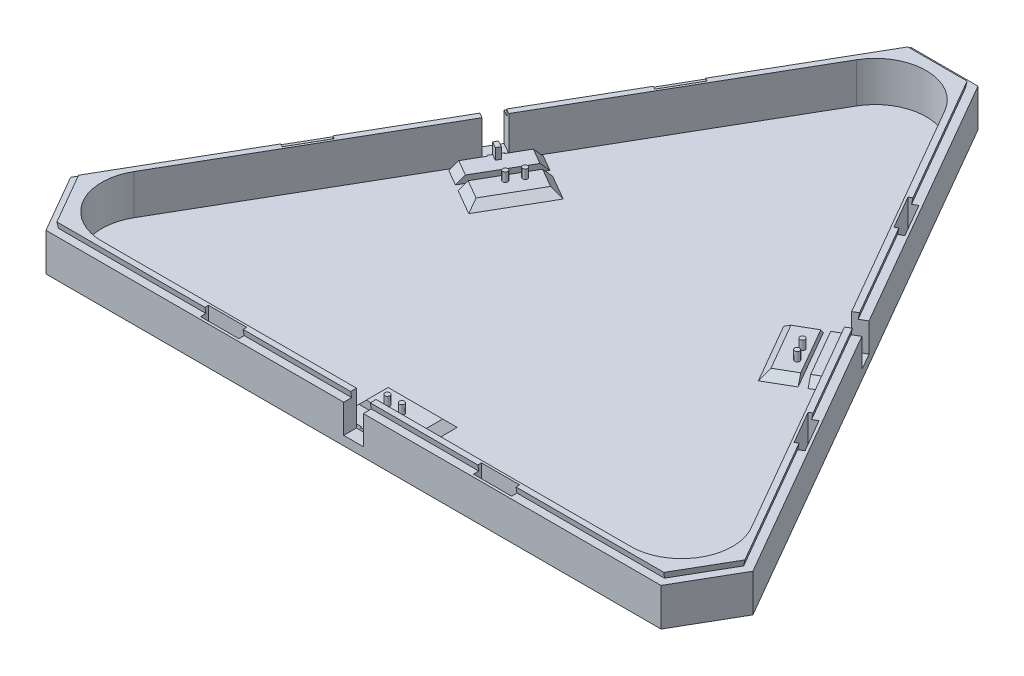
from build123d import *

# Parameters (mm, degrees)
BOSS_EXTRU_1_DEPTH                        = 12
ENL_V_MAT_EXTRU_1_DEPTH                   = 158.792057257
ENL_V_MAT_EXTRU_2_DEPTH                   = 11
ESQUISSE4_W                               = 5.4
ESQUISSE4_H                               = 3.5
ENL_V_MAT_EXTRU_3_DEPTH                   = 9.5
BOSS_EXTRU_2_DEPTH                        = 2
ESQUISSE13_R                              = 0.7
BOSS_EXTRU_3_DEPTH                        = 2.5
BOSS_EXTRU_8_DEPTH                        = 3
CHANFREIN4_SIZE                           = 2
ENL_V_MAT_EXTRU_11_DEPTH                  = 2
R_P_TITION_START                          = 1
R_P_TITION_CIRCULAIRE1_OUTLINE_W          = 1.2
R_P_TITION_CIRCULAIRE1_OUTLINE_H          = 2
R_P_TITION_CIRCULAIRE1_OUTLINE_R          = 0.7
R_P_TITION_CIRCULAIRE1_DEPTH              = 4.5
R_P_TITION_START_2                        = 5.5
R_P_TITION_CIRCULAIRE1_2_OUTLINE_W        = 1.2
R_P_TITION_CIRCULAIRE1_2_OUTLINE_H        = 2
R_P_TITION_CIRCULAIRE1_2_DEPTH            = 0.5
ENL_V_DE_MAT_EXTRU_MINCE1_DEPTH           = 1.6
ENL_V_DE_MAT_EXTRU_MINCE1_DRAFT           = 10
ENL_V_DE_MAT_EXTRU_MINCE1_PROFILE_2_DEPTH = 1.6
ENL_V_DE_MAT_EXTRU_MINCE1_PROFILE_2_DRAFT = 10
ENL_V_DE_MAT_EXTRU_MINCE1_PROFILE_3_DEPTH = 1.6
ENL_V_DE_MAT_EXTRU_MINCE1_PROFILE_3_DRAFT = 10
ESQUISSE18_W                              = 10.5
ESQUISSE18_H                              = 2.2
ENL_V_MAT_EXTRU_10_DEPTH                  = 11


with BuildPart() as part:
    # Esquisse1 → Boss.-Extru.1 (new body)
    with BuildSketch(Plane(origin=(0, 0, 0), x_dir=(1, 0, 0), z_dir=(0, 1, 0))):
        Polygon((-103, -59.467077727), (103, -59.467077727), (0, 118.934155453), align=None)
    extrude(amount=BOSS_EXTRU_1_DEPTH)

    # Esquisse2 → Enlèv. mat.-Extru.1 (cut, through all)
    with BuildSketch(Plane(origin=(0, 12, 0), x_dir=(1, 0, 0), z_dir=(0, 1, 0))):
        Polygon((-9.237604307, 102.934155453), (9.237604307, 102.934155453), (0, 118.934155453), align=None)
        Polygon((103, -59.467077727), (93.762395693, -43.467077727), (84.524791386, -59.467077727), align=None)
        Polygon((-103, -59.467077727), (-84.524791386, -59.467077727), (-93.762395693, -43.467077727), align=None)
    extrude(amount=-ENL_V_MAT_EXTRU_1_DEPTH, mode=Mode.SUBTRACT)

    # Esquisse3 → Enlèv. mat.-Extru.2 (cut)
    with BuildSketch(Plane(origin=(0, 12, 0), x_dir=(1, 0, 0), z_dir=(0, 1, 0))):
        with BuildLine():
            Line((84.813466521, -34.967077727), (12.124355653, 90.934155453))
            ThreePointArc((12.124355653, 90.934155453), (0, 97.934155453), (-12.124355653, 90.934155453))
            Line((-12.124355653, 90.934155453), (-84.813466521, -34.967077727))
            ThreePointArc((-84.813466521, -34.967077727), (-84.813466521, -48.967077727), (-72.689110868, -55.967077727))
            Line((-72.689110868, -55.967077727), (72.689110868, -55.967077727))
            ThreePointArc((72.689110868, -55.967077727), (84.813466521, -48.967077727), (84.813466521, -34.967077727))
        make_face()
    extrude(amount=-ENL_V_MAT_EXTRU_2_DEPTH, mode=Mode.SUBTRACT)

    # Esquisse4 → Enlèv. mat.-Extru.3 (cut)
    with BuildSketch(Plane(origin=(0, 12, 0), x_dir=(1, 0, 0), z_dir=(0, 1, 0))):
        Polygon((49.818911087, 25.645270273), (47.118911087, 30.321807453), (50.15, 32.071807453), (52.85, 27.395270273), align=None)
        with Locations((0, -57.717077727)):
            Rectangle(ESQUISSE4_W, ESQUISSE4_H)
        Polygon((-50.15, 32.071807453), (-47.118911087, 30.321807453), (-49.818911087, 25.645270273), (-52.85, 27.395270273), align=None)
    extrude(amount=-ENL_V_MAT_EXTRU_3_DEPTH, mode=Mode.SUBTRACT)

    # Esquisse12 → Boss.-Extru.2 (add)
    with BuildSketch(Plane(origin=(0, 1, 0), x_dir=(1, 0, 0), z_dir=(0, 1, 0))):
        Polygon((33.027568136, 27.728729392), (40.527568136, 14.738348335), (51.785898385, 21.238348335), (48.910898385, 26.217994407), (49.170706006, 26.367994407), (47.420706006, 29.39908332), (47.160898385, 29.24908332), (44.285898385, 34.228729392), align=None)
    extrude(amount=BOSS_EXTRU_2_DEPTH)

    # Esquisse13 → Boss.-Extru.3 (add)
    with BuildSketch(Plane(origin=(0, 3, 0), x_dir=(1, 0, 0), z_dir=(0, 1, 0))):
        with Locations(Location((40.164874832, 23.766551565, 0), (0, 0, 90))):
            Circle(ESQUISSE13_R)
        with Locations(Location((42.164874832, 20.30244995, 0), (0, 0, 90))):
            Circle(ESQUISSE13_R)
    extrude(amount=BOSS_EXTRU_3_DEPTH)

    # Esquisse20 → Boss.-Extru.8 (add, symmetric)
    with BuildSketch(Plane(origin=(0, 3, 0), x_dir=(1, 0, 0), z_dir=(0, 1, 0))):
        Polygon((47.995706006, 28.403154106), (48.595706006, 27.363923621), (46.863655198, 26.363923621), (46.263655198, 27.403154106), align=None)
    extrude(amount=BOSS_EXTRU_8_DEPTH, both=True)

    # Chanfrein4
    chanfrein4_edges = [part.edges().sort_by_distance(p)[0] for p in [
        (38.65673326, 1, -30.978729392),
        (36.777568136, 1, -21.233538863),
        (46.15673326, 1, -17.988348335),
    ]]
    chamfer(chanfrein4_edges, length=CHANFREIN4_SIZE - 0.0001)  # a hair under: the kernel refuses the full size

    # Esquisse21 → Enlèv. mat.-Extru.11 (cut)
    with BuildSketch(Plane(origin=(0, 3, 0), x_dir=(1, 0, 0), z_dir=(0, 1, 0))):
        Polygon((37.223720558, 32.460780199), (38.955771366, 33.460780199), (48.455771366, 17.006297527), (46.723720558, 16.006297527), align=None)
    extrude(amount=-ENL_V_MAT_EXTRU_11_DEPTH, mode=Mode.SUBTRACT)

    # Répétition circulaire1: read off the stored shape, not the designer's step
    # Répétition circulaire1 outline → Répétition circulaire1 (add)
    with BuildSketch(Plane(origin=(0, 0, 0), x_dir=(1, 0, 0), z_dir=(0, 1, 0)).offset(R_P_TITION_START)):
        Polygon((-47.995706006, 28.403154106), (-48.595706006, 27.363923621), (-46.863655198, 26.363923621), (-46.263655198, 27.403154106), align=None)
        with Locations((0, -54.767077727)):
            Rectangle(R_P_TITION_CIRCULAIRE1_OUTLINE_W, R_P_TITION_CIRCULAIRE1_OUTLINE_H)
        with Locations((-40.664874832, 22.900526161)):
            Circle(R_P_TITION_CIRCULAIRE1_OUTLINE_R)
        with Locations((-38.664874832, 26.364627777)):
            Circle(R_P_TITION_CIRCULAIRE1_OUTLINE_R)
        with Locations((0.5, -46.667077727)):
            Circle(R_P_TITION_CIRCULAIRE1_OUTLINE_R)
        with Locations((-3.5, -46.667077727)):
            Circle(R_P_TITION_CIRCULAIRE1_OUTLINE_R)
    extrude(amount=R_P_TITION_CIRCULAIRE1_DEPTH)

    # R_p_tition circulaire1 2 outline → R_p_tition circulaire1 2 (add)
    with BuildSketch(Plane(origin=(0, 0, 0), x_dir=(1, 0, 0), z_dir=(0, 1, 0)).offset(R_P_TITION_START_2)):
        Polygon((-47.995706006, 28.403154106), (-48.595706006, 27.363923621), (-46.863655198, 26.363923621), (-46.263655198, 27.403154106), align=None)
        with Locations((0, -54.767077727)):
            Rectangle(R_P_TITION_CIRCULAIRE1_2_OUTLINE_W, R_P_TITION_CIRCULAIRE1_2_OUTLINE_H)
    extrude(amount=R_P_TITION_CIRCULAIRE1_2_DEPTH)

    # R_p_tition circulaire1 3: loft between two sections, ruled curve by curve
    r_p_tition_circulaire1_3_from = [
        Edge.make_line((-38.223720558, 3, -30.728729392), (-33.027568136, 3, -27.728729392)),
        Edge.make_line((-45.723720558, 3, -17.738348335), (-40.527568136, 3, -14.738348335)),
        Edge.make_line((-33.027568136, 3, -27.728729392), (-40.527568136, 3, -14.738348335)),
        Edge.make_line((-45.723720558, 3, -17.738348335), (-38.223720558, 3, -30.728729392)),
    ]
    r_p_tition_circulaire1_3_to = [
        Edge.make_line((-37.223720558, 1, -32.460780199), (-30.295517328, 1, -28.460780199)),
        Edge.make_line((-46.723720558, 1, -16.006297527), (-39.795517328, 1, -12.006297527)),
        Edge.make_line((-30.295517328, 1, -28.460780199), (-39.795517328, 1, -12.006297527)),
        Edge.make_line((-46.723720558, 1, -16.006297527), (-37.223720558, 1, -32.460780199)),
    ]
    r_p_tition_circulaire1_3 = Solid(Shell([*[Face.make_surface_from_curves(r_p_tition_circulaire1_3_from[k], r_p_tition_circulaire1_3_to[k]) for k in range(4)], Face(Wire(r_p_tition_circulaire1_3_from)), Face(Wire(r_p_tition_circulaire1_3_to))]))
    add(r_p_tition_circulaire1_3)

    # R_p_tition circulaire1 4: loft between two sections, ruled curve by curve
    r_p_tition_circulaire1_4_from = [
        Edge.make_line((-7.5, 3, 48.467077727), (-7.5, 3, 42.467077727)),
        Edge.make_line((7.5, 3, 48.467077727), (7.5, 3, 42.467077727)),
        Edge.make_line((-7.5, 3, 42.467077727), (7.5, 3, 42.467077727)),
        Edge.make_line((7.5, 3, 48.467077727), (-7.5, 3, 48.467077727)),
    ]
    r_p_tition_circulaire1_4_to = [
        Edge.make_line((-9.5, 1, 48.467077727), (-9.5, 1, 40.467077727)),
        Edge.make_line((9.5, 1, 48.467077727), (9.5, 1, 40.467077727)),
        Edge.make_line((-9.5, 1, 40.467077727), (9.5, 1, 40.467077727)),
        Edge.make_line((9.5, 1, 48.467077727), (-9.5, 1, 48.467077727)),
    ]
    r_p_tition_circulaire1_4 = Solid(Shell([*[Face.make_surface_from_curves(r_p_tition_circulaire1_4_from[k], r_p_tition_circulaire1_4_to[k]) for k in range(4)], Face(Wire(r_p_tition_circulaire1_4_from)), Face(Wire(r_p_tition_circulaire1_4_to))]))
    add(r_p_tition_circulaire1_4)

    # R_p_tition circulaire1 5: loft between two sections, ruled curve by curve
    r_p_tition_circulaire1_5_from = [
        Edge.make_line((-39.955771366, 3, -31.728729392), (-44.285898385, 3, -34.228729392)),
        Edge.make_line((-47.455771366, 3, -18.738348335), (-51.785898385, 3, -21.238348335)),
        Edge.make_line((-47.160898385, 3, -29.24908332), (-44.285898385, 3, -34.228729392)),
        Edge.make_line((-51.785898385, 3, -21.238348335), (-48.910898385, 3, -26.217994407)),
        Edge.make_line((-47.420706006, 3, -29.39908332), (-47.160898385, 3, -29.24908332)),
        Edge.make_line((-48.910898385, 3, -26.217994407), (-49.170706006, 3, -26.367994407)),
        Edge.make_line((-39.955771366, 3, -31.728729392), (-47.455771366, 3, -18.738348335)),
        Edge.make_line((-49.170706006, 3, -26.367994407), (-47.420706006, 3, -29.39908332)),
    ]
    r_p_tition_circulaire1_5_to = [
        Edge.make_line((-38.955771366, 1, -33.460780199), (-43.285898385, 1, -35.960780199)),
        Edge.make_line((-48.455771366, 1, -17.006297527), (-52.785898385, 1, -19.506297527)),
        Edge.make_line((-47.160898385, 1, -29.24908332), (-43.285898385, 1, -35.960780199)),
        Edge.make_line((-52.785898385, 1, -19.506297527), (-48.910898385, 1, -26.217994407)),
        Edge.make_line((-47.420706006, 1, -29.39908332), (-47.160898385, 1, -29.24908332)),
        Edge.make_line((-48.910898385, 1, -26.217994407), (-49.170706006, 1, -26.367994407)),
        Edge.make_line((-38.955771366, 1, -33.460780199), (-48.455771366, 1, -17.006297527)),
        Edge.make_line((-49.170706006, 1, -26.367994407), (-47.420706006, 1, -29.39908332)),
    ]
    r_p_tition_circulaire1_5 = Solid(Shell([*[Face.make_surface_from_curves(r_p_tition_circulaire1_5_from[k], r_p_tition_circulaire1_5_to[k]) for k in range(8)], Face(Wire(r_p_tition_circulaire1_5_from)), Face(Wire(r_p_tition_circulaire1_5_to))]))
    add(r_p_tition_circulaire1_5)

    # R_p_tition circulaire1 6: loft between two sections, ruled curve by curve
    r_p_tition_circulaire1_6_from = [
        Edge.make_line((-7.5, 3, 50.467077727), (-7.5, 3, 55.467077727)),
        Edge.make_line((7.5, 3, 50.467077727), (7.5, 3, 55.467077727)),
        Edge.make_line((-1.75, 3, 55.467077727), (-7.5, 3, 55.467077727)),
        Edge.make_line((7.5, 3, 55.467077727), (1.75, 3, 55.467077727)),
        Edge.make_line((-1.75, 3, 55.767077727), (-1.75, 3, 55.467077727)),
        Edge.make_line((1.75, 3, 55.467077727), (1.75, 3, 55.767077727)),
        Edge.make_line((-7.5, 3, 50.467077727), (7.5, 3, 50.467077727)),
        Edge.make_line((1.75, 3, 55.767077727), (-1.75, 3, 55.767077727)),
    ]
    r_p_tition_circulaire1_6_to = [
        Edge.make_line((-9.5, 1, 50.467077727), (-9.5, 1, 55.467077727)),
        Edge.make_line((9.5, 1, 50.467077727), (9.5, 1, 55.467077727)),
        Edge.make_line((-1.75, 1, 55.467077727), (-9.5, 1, 55.467077727)),
        Edge.make_line((9.5, 1, 55.467077727), (1.75, 1, 55.467077727)),
        Edge.make_line((-1.75, 1, 55.767077727), (-1.75, 1, 55.467077727)),
        Edge.make_line((1.75, 1, 55.467077727), (1.75, 1, 55.767077727)),
        Edge.make_line((-9.5, 1, 50.467077727), (9.5, 1, 50.467077727)),
        Edge.make_line((1.75, 1, 55.767077727), (-1.75, 1, 55.767077727)),
    ]
    r_p_tition_circulaire1_6 = Solid(Shell([*[Face.make_surface_from_curves(r_p_tition_circulaire1_6_from[k], r_p_tition_circulaire1_6_to[k]) for k in range(8)], Face(Wire(r_p_tition_circulaire1_6_from)), Face(Wire(r_p_tition_circulaire1_6_to))]))
    add(r_p_tition_circulaire1_6)


with BuildPart() as enl_v_de_mat_extru_mince1_tool:
    # Esquisse17 → Enlèv. de mat.-Extru.-Mince1 (with draft: the straight prism first)
    with BuildSketch(Plane(origin=(0, 12, 0), x_dir=(1, 0, 0), z_dir=(0, 1, 0))):
        Polygon((50.15, 32.071807453), (9.237604307, 102.934155453), (-9.237604307, 102.934155453), (-50.15, 32.071807453), (-48.504551733, 31.121807453), (-8.140638796, 101.034155453), (8.140638796, 101.034155453), (48.504551733, 31.121807453), align=None)
    extrude(amount=-ENL_V_DE_MAT_EXTRU_MINCE1_DEPTH)
    # Enlèv. de mat.-Extru.-Mince1: the draft: its side faces are tilted about the plane it starts from
    enl_v_de_mat_extru_mince1_sides = [enl_v_de_mat_extru_mince1_tool.faces().sort_by_distance(p)[0] for p in [
        (29.693802154, 11.2, -67.502981453),
        (0, 11.2, -102.934155453),
        (-29.693802154, 11.2, -67.502981453),
        (-49.327275866, 11.2, -31.596807453),
        (-28.322595264, 11.2, -66.077981453),
        (0, 11.2, -101.034155453),
        (28.322595264, 11.2, -66.077981453),
        (49.327275866, 11.2, -31.596807453),
    ]]
    draft(enl_v_de_mat_extru_mince1_sides, Plane(origin=(0, 12, 0), x_dir=(1, 0, 0), z_dir=(0, 1, 0)), ENL_V_DE_MAT_EXTRU_MINCE1_DRAFT)


with BuildPart() as part_1:
    add(part.part)

    # Enlèv. de mat.-Extru.-Mince1: cut by enl_v_de_mat_extru_mince1_tool
    add(enl_v_de_mat_extru_mince1_tool.part, mode=Mode.SUBTRACT)


with BuildPart() as enl_v_de_mat_extru_mince1_profile_2_tool:
    # Esquisse17 → Enlèv. de mat.-Extru.-Mince1 profile 2 (with draft: the straight prism first)
    with BuildSketch(Plane(origin=(0, 12, 0), x_dir=(1, 0, 0), z_dir=(0, 1, 0))):
        Polygon((-52.85, 27.395270273), (-93.762395693, -43.467077727), (-84.524791386, -59.467077727), (-2.7, -59.467077727), (-2.7, -57.567077727), (-83.427825874, -57.567077727), (-91.56846467, -43.467077727), (-51.204551733, 26.445270273), align=None)
    extrude(amount=-ENL_V_DE_MAT_EXTRU_MINCE1_PROFILE_2_DEPTH)
    # Enlèv. de mat.-Extru.-Mince1 profile 2: the draft: its side faces are tilted about the plane it starts from
    enl_v_de_mat_extru_mince1_profile_2_sides = [enl_v_de_mat_extru_mince1_profile_2_tool.faces().sort_by_distance(p)[0] for p in [
        (-73.306197846, 11.2, 8.035903727),
        (-89.143593539, 11.2, 51.467077727),
        (-43.612395693, 11.2, 59.467077727),
        (-2.7, 11.2, 58.517077727),
        (-43.063912937, 11.2, 57.567077727),
        (-87.498145272, 11.2, 50.517077727),
        (-71.386508201, 11.2, 8.510903727),
        (-52.027275866, 11.2, -26.920270273),
    ]]
    draft(enl_v_de_mat_extru_mince1_profile_2_sides, Plane(origin=(0, 12, 0), x_dir=(1, 0, 0), z_dir=(0, 1, 0)), ENL_V_DE_MAT_EXTRU_MINCE1_PROFILE_2_DRAFT)


with BuildPart() as part_2:
    add(part_1.part)

    # Enlèv. de mat.-Extru.-Mince1 profile 2: cut by enl_v_de_mat_extru_mince1_profile_2_tool
    add(enl_v_de_mat_extru_mince1_profile_2_tool.part, mode=Mode.SUBTRACT)


with BuildPart() as enl_v_de_mat_extru_mince1_profile_3_tool:
    # Esquisse17 → Enlèv. de mat.-Extru.-Mince1 profile 3 (with draft: the straight prism first)
    with BuildSketch(Plane(origin=(0, 12, 0), x_dir=(1, 0, 0), z_dir=(0, 1, 0))):
        Polygon((2.7, -59.467077727), (84.524791386, -59.467077727), (93.762395693, -43.467077727), (52.85, 27.395270273), (51.204551733, 26.445270273), (91.56846467, -43.467077727), (83.427825874, -57.567077727), (2.7, -57.567077727), align=None)
    extrude(amount=-ENL_V_DE_MAT_EXTRU_MINCE1_PROFILE_3_DEPTH)
    # Enlèv. de mat.-Extru.-Mince1 profile 3: the draft: its side faces are tilted about the plane it starts from
    enl_v_de_mat_extru_mince1_profile_3_sides = [enl_v_de_mat_extru_mince1_profile_3_tool.faces().sort_by_distance(p)[0] for p in [
        (43.612395693, 11.2, 59.467077727),
        (89.143593539, 11.2, 51.467077727),
        (73.306197846, 11.2, 8.035903727),
        (52.027275866, 11.2, -26.920270273),
        (71.386508201, 11.2, 8.510903727),
        (87.498145272, 11.2, 50.517077727),
        (43.063912937, 11.2, 57.567077727),
        (2.7, 11.2, 58.517077727),
    ]]
    draft(enl_v_de_mat_extru_mince1_profile_3_sides, Plane(origin=(0, 12, 0), x_dir=(1, 0, 0), z_dir=(0, 1, 0)), ENL_V_DE_MAT_EXTRU_MINCE1_PROFILE_3_DRAFT)


with BuildPart() as part_3:
    add(part_2.part)

    # Enlèv. de mat.-Extru.-Mince1 profile 3: cut by enl_v_de_mat_extru_mince1_profile_3_tool
    add(enl_v_de_mat_extru_mince1_profile_3_tool.part, mode=Mode.SUBTRACT)

    # Esquisse18 → Enlèv. mat.-Extru.10 (cut)
    with BuildSketch(Plane(origin=(0, 12, 0), x_dir=(1, 0, 0), z_dir=(0, 1, 0))):
        with Locations((37.5, -57.667077727)):
            Rectangle(ESQUISSE18_W, ESQUISSE18_H)
        with Locations((-37.5, -57.667077727)):
            Rectangle(ESQUISSE18_W, ESQUISSE18_H)
        Polygon((-65.113526329, 0.354219591), (-70.363526329, -8.739047149), (-72.268782217, -7.639047149), (-67.018782217, 1.454219591), align=None)
        Polygon((-32.863526329, 56.212858135), (-34.768782217, 57.312858135), (-29.518782217, 66.406124875), (-27.613526329, 65.306124875), align=None)
        Polygon((32.863526329, 56.212858135), (27.613526329, 65.306124875), (29.518782217, 66.406124875), (34.768782217, 57.312858135), align=None)
        Polygon((65.113526329, 0.354219591), (67.018782217, 1.454219591), (72.268782217, -7.639047149), (70.363526329, -8.739047149), align=None)
    extrude(amount=-ENL_V_MAT_EXTRU_10_DEPTH, mode=Mode.SUBTRACT)


solid = part_3.part
